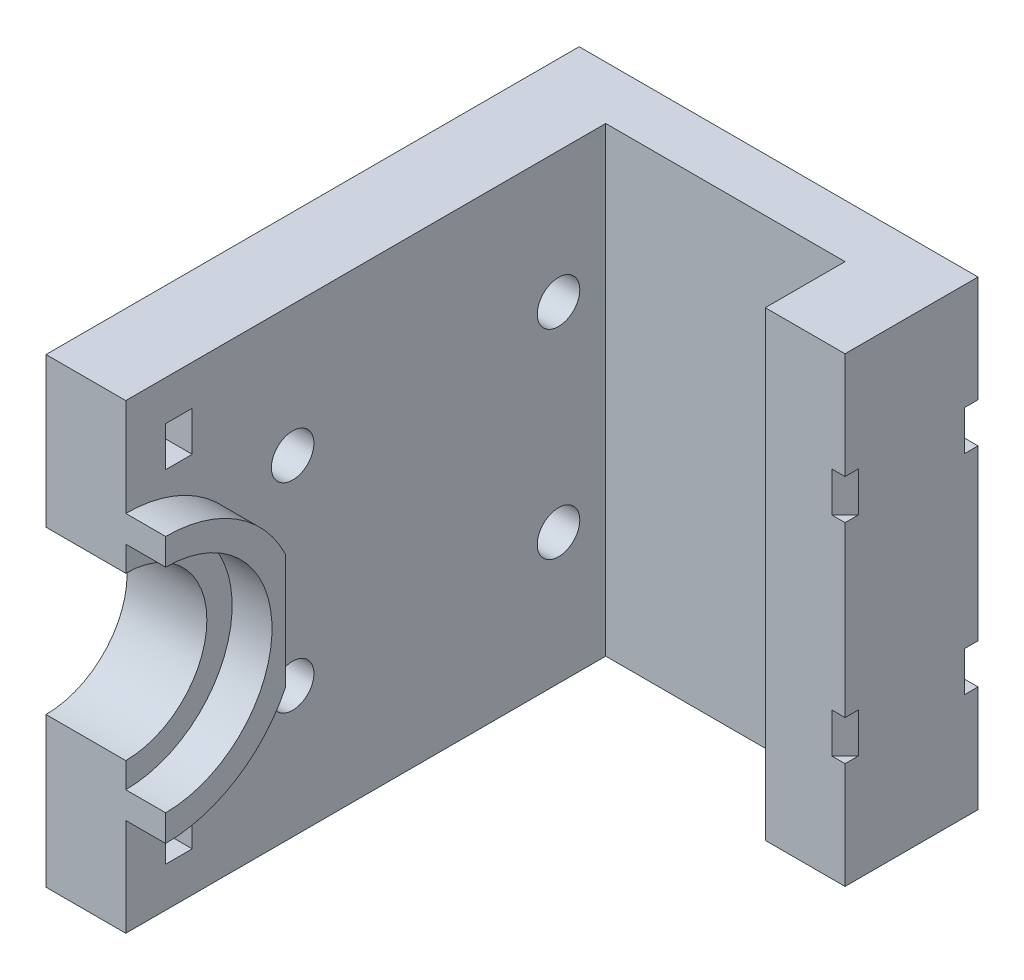
from build123d import *

# Parameters (mm, degrees)
SKETCH_2_W          = 2
SKETCH_2_H          = 3
SKETCH_2_R          = 1.6
EXTRUDE_1_DEPTH     = 6
EXTRUDE_2_DEPTH     = 3
SKETCH_4_W          = 4
SKETCH_4_H          = 34.7
EXTRUDE_3_DEPTH     = 24
SKETCH_15_W         = 10
SKETCH_15_H         = 34.7
EXTRUDE_8_DEPTH     = 6
SKETCH_16_W         = 2
SKETCH_16_H         = 3
CUT_EXTRUDE_4_DEPTH = 6
CUT_EXTRUDE_5_DEPTH = 3
CUT_EXTRUDE_6_DEPTH = 3


with BuildPart() as part:
    # 草圖2 → 填料-伸長1 (new body)
    with BuildSketch(Plane(origin=(0, 0, 0), x_dir=(0, 0, -1), z_dir=(1, 0, 0))):
        with BuildLine():
            Line((13.55, 17.35), (-13.55, 17.35))
            Line((-13.55, 17.35), (-22.55, 17.35))
            Line((-22.55, 17.35), (-22.55, 6.1))
            ThreePointArc((-22.55, 6.1), (-16.45, 0), (-22.55, -6.1))
            Line((-22.55, -6.1), (-22.55, -17.35))
            Line((-22.55, -17.35), (-13.55, -17.35))
            Line((-13.55, -17.35), (13.55, -17.35))
            Line((13.55, -17.35), (13.55, 17.35))
        make_face()
        with Locations((-18.55, -12.85)):
            Rectangle(SKETCH_2_W, SKETCH_2_H, mode=Mode.SUBTRACT)
        with Locations((-10, -7.5)):
            Circle(SKETCH_2_R, mode=Mode.SUBTRACT)
        with Locations((10, -7.5)):
            Circle(SKETCH_2_R, mode=Mode.SUBTRACT)
        with Locations((-10, 7.5)):
            Circle(SKETCH_2_R, mode=Mode.SUBTRACT)
        with Locations((-18.55, 12.85)):
            Rectangle(SKETCH_2_W, SKETCH_2_H, mode=Mode.SUBTRACT)
        with Locations((10, 7.5)):
            Circle(SKETCH_2_R, mode=Mode.SUBTRACT)
    extrude(amount=EXTRUDE_1_DEPTH)

    # 草圖3 → 填料-伸長2 (add)
    with BuildSketch(Plane(origin=(6, 0, 0), x_dir=(0, 0, -1), z_dir=(1, 0, 0))):
        with BuildLine():
            Line((-13.55, 4.358898944), (-13.55, -4.358898944))
            ThreePointArc((-13.55, -4.358898944), (-17.239114454, -8.473163206), (-22.55, -10))
            Line((-22.55, -10), (-22.55, -8))
            ThreePointArc((-22.55, -8), (-14.55, 0), (-22.55, 8))
            Line((-22.55, 8), (-22.55, 10))
            ThreePointArc((-22.55, 10), (-17.239114454, 8.473163206), (-13.55, 4.358898944))
        make_face()
    extrude(amount=EXTRUDE_2_DEPTH)

    # 草圖4 → 填料-伸長3 (add)
    with BuildSketch(Plane.ZY):
        with Locations((-15.55, 0)):
            Rectangle(SKETCH_4_W, SKETCH_4_H)
    extrude(amount=-EXTRUDE_3_DEPTH)

    # 草圖15 → 填料-伸長8 (add)
    with BuildSketch(Plane(origin=(24, 0, 0), x_dir=(0, 0, -1), z_dir=(1, 0, 0))):
        with Locations((12.55, 0)):
            Rectangle(SKETCH_15_W, SKETCH_15_H)
    extrude(amount=EXTRUDE_8_DEPTH)

    # 草圖16 → 除料-伸長4 (cut)
    with BuildSketch(Plane(origin=(0, 0, -17.55), x_dir=(-1, 0, 0), z_dir=(0, 0, -1))):
        with Locations((-23, 7.85)):
            Rectangle(SKETCH_16_W, SKETCH_16_H)
        with Locations((-23, -7.85)):
            Rectangle(SKETCH_16_W, SKETCH_16_H)
    extrude(amount=-CUT_EXTRUDE_4_DEPTH, mode=Mode.SUBTRACT)

    # 草圖17 → 除料-伸長5 (cut)
    with BuildSketch(Plane(origin=(0, -9.35, 0), x_dir=(-1, 0, 0), z_dir=(0, -1, 0))):
        Polygon((-30, 17.55), (-29, 17.55), (-30, 16.55), align=None)
        Polygon((-30, 7.55), (-30, 8.55), (-29, 7.55), align=None)
    extrude(amount=-CUT_EXTRUDE_5_DEPTH, mode=Mode.SUBTRACT)

    # 草圖18 → 除料-伸長6 (cut)
    with BuildSketch(Plane(origin=(0, 9.35, 0), x_dir=(1, 0, 0), z_dir=(0, 1, 0))):
        Polygon((30, 17.55), (29, 17.55), (30, 16.55), align=None)
        Polygon((30, 7.55), (30, 8.55), (29, 7.55), align=None)
    extrude(amount=-CUT_EXTRUDE_6_DEPTH, mode=Mode.SUBTRACT)


solid = part.part
